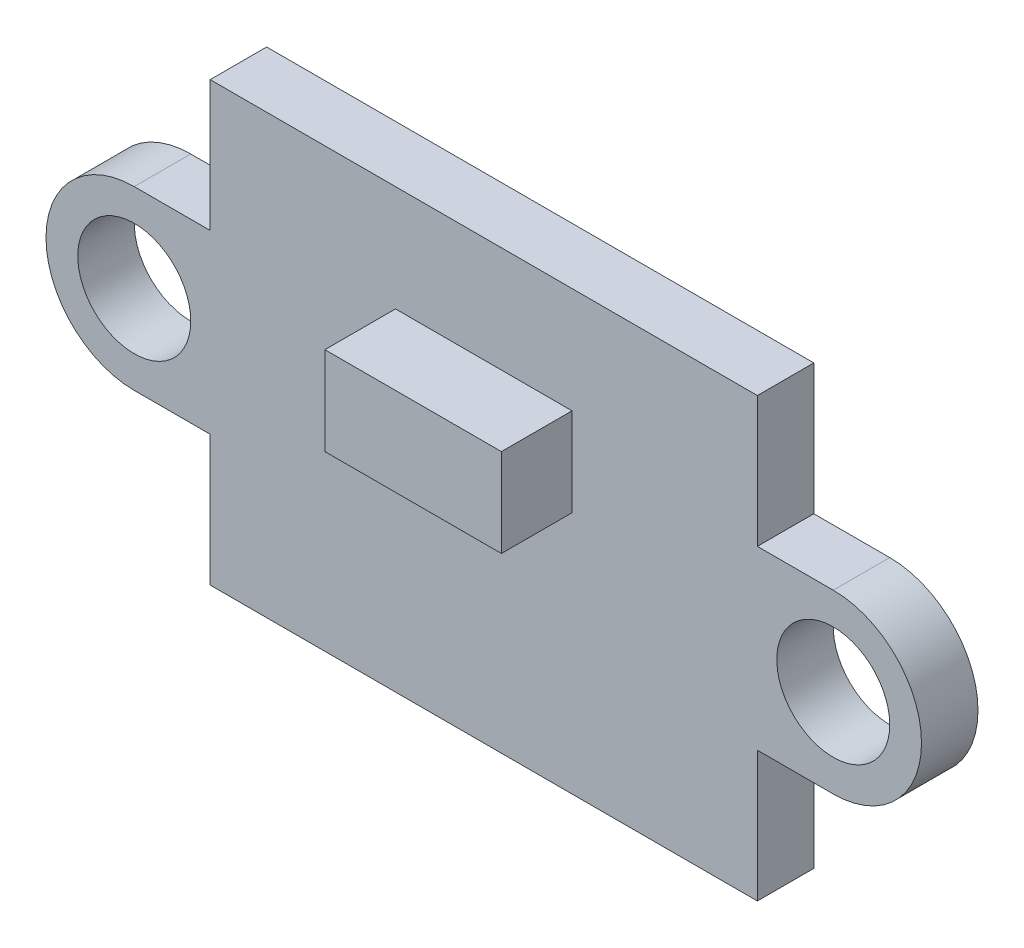
from build123d import *

# Parameters (mm, degrees)
SKETCH1_R           = 1.6
BOSS_EXTRUDE1_DEPTH = 1.6
SKETCH2_W           = 5
SKETCH2_H           = 2.5
BOSS_EXTRUDE2_DEPTH = 2


with BuildPart() as part:
    # Sketch1 → Boss-Extrude1 (new body)
    with BuildSketch(Plane.XY):
        with BuildLine():
            Line((-7.75, 6.2), (7.75, 6.2))
            Line((7.75, 6.2), (7.75, 2.5))
            Line((7.75, 2.5), (9.9, 2.5))
            ThreePointArc((9.9, 2.5), (12.4, 0), (9.9, -2.5))
            Line((9.9, -2.5), (7.75, -2.5))
            Line((7.75, -2.5), (7.75, -6.2))
            Line((7.75, -6.2), (-7.75, -6.2))
            Line((-7.75, -6.2), (-7.75, -2.5))
            Line((-7.75, -2.5), (-9.9, -2.5))
            ThreePointArc((-9.9, -2.5), (-12.4, 0), (-9.9, 2.5))
            Line((-9.9, 2.5), (-7.75, 2.5))
            Line((-7.75, 2.5), (-7.75, 6.2))
        make_face()
        with Locations((-9.9, 0)):
            Circle(SKETCH1_R, mode=Mode.SUBTRACT)
        with Locations((9.9, 0)):
            Circle(SKETCH1_R, mode=Mode.SUBTRACT)
    extrude(amount=BOSS_EXTRUDE1_DEPTH)

    # Sketch2 → Boss-Extrude2 (add)
    with BuildSketch(Plane.XY.offset(1.6)):
        with Locations((0, 1.95)):
            Rectangle(SKETCH2_W, SKETCH2_H)
    extrude(amount=BOSS_EXTRUDE2_DEPTH)


solid = part.part
